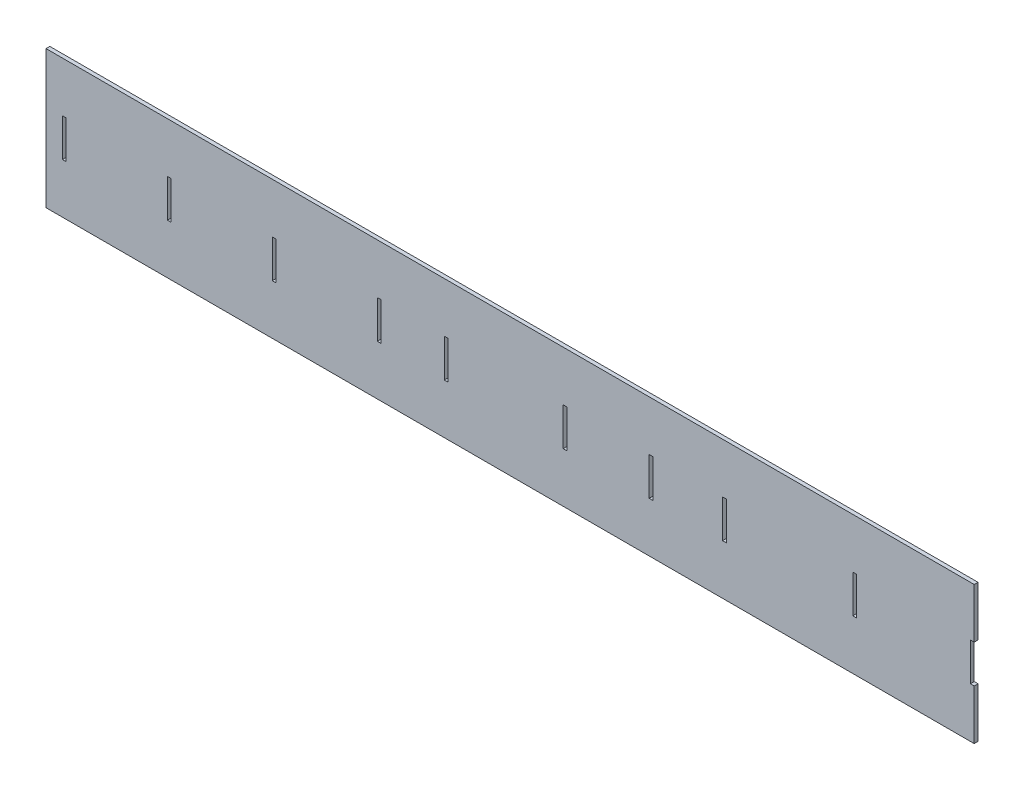
from build123d import *

# Parameters (mm, degrees)
SKETCH1_W           = 3
SKETCH1_H           = 30
BOSS_EXTRUDE1_DEPTH = 3


with BuildPart() as part:
    # Sketch1 → Boss-Extrude1 (new body)
    with BuildSketch(Plane.XY):
        Polygon((110.35106383, 109), (844.35106383, 109), (844.35106383, 69.5), (841.35106383, 69.5), (841.35106383, 39.5), (844.35106383, 39.5), (844.35106383, 0), (110.35106383, 0), align=None)
        with Locations((124.85106383, 54.5)):
            Rectangle(SKETCH1_W, SKETCH1_H, mode=Mode.SUBTRACT)
        with Locations((207.85106383, 54.5)):
            Rectangle(SKETCH1_W, SKETCH1_H, mode=Mode.SUBTRACT)
        with Locations((290.85106383, 54.5)):
            Rectangle(SKETCH1_W, SKETCH1_H, mode=Mode.SUBTRACT)
        with Locations((373.85106383, 54.5)):
            Rectangle(SKETCH1_W, SKETCH1_H, mode=Mode.SUBTRACT)
        with Locations((426.85106383, 54.5)):
            Rectangle(SKETCH1_W, SKETCH1_H, mode=Mode.SUBTRACT)
        with Locations((520.85106383, 54.5)):
            Rectangle(SKETCH1_W, SKETCH1_H, mode=Mode.SUBTRACT)
        with Locations((588.85106383, 54.5)):
            Rectangle(SKETCH1_W, SKETCH1_H, mode=Mode.SUBTRACT)
        with Locations((646.85106383, 54.5)):
            Rectangle(SKETCH1_W, SKETCH1_H, mode=Mode.SUBTRACT)
        with Locations((749.85106383, 54.5)):
            Rectangle(SKETCH1_W, SKETCH1_H, mode=Mode.SUBTRACT)
    extrude(amount=BOSS_EXTRUDE1_DEPTH)


solid = part.part
